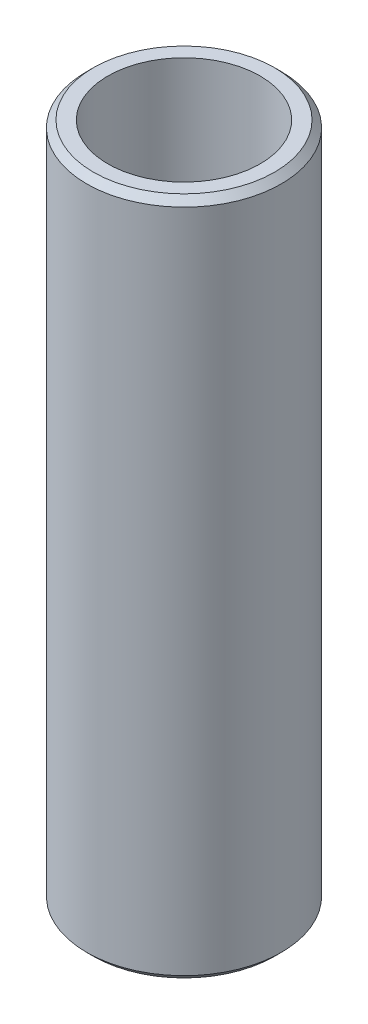
from build123d import *

# Parameters (mm, degrees)
SKETCH1_R           = 32.5
BOSS_EXTRUDE1_DEPTH = 226.802007326
SKETCH2_R           = 25.440591862
CUT_EXTRUDE1_DEPTH  = 232.41229554
CHAMFER1_SIZE       = 2.256287478


with BuildPart() as part:
    # Sketch1 → Boss-Extrude1 (new body)
    with BuildSketch(Plane(origin=(0, 0, 0), x_dir=(1, 0, 0), z_dir=(0, 1, 0))):
        Circle(SKETCH1_R)
    extrude(amount=BOSS_EXTRUDE1_DEPTH)

    # Sketch2 → Cut-Extrude1 (cut, through all)
    with BuildSketch(Plane(origin=(0, 0, 0), x_dir=(1, 0, 0), z_dir=(0, 1, 0))):
        Circle(SKETCH2_R)
    extrude(amount=CUT_EXTRUDE1_DEPTH, mode=Mode.SUBTRACT)

    # Chamfer1
    chamfer1_edges = [part.edges().sort_by_distance(p)[0] for p in [
        (-32.5, 226.802007326, 0),
        (-32.5, 0, 0),
    ]]
    chamfer(chamfer1_edges, length=CHAMFER1_SIZE)


solid = part.part
